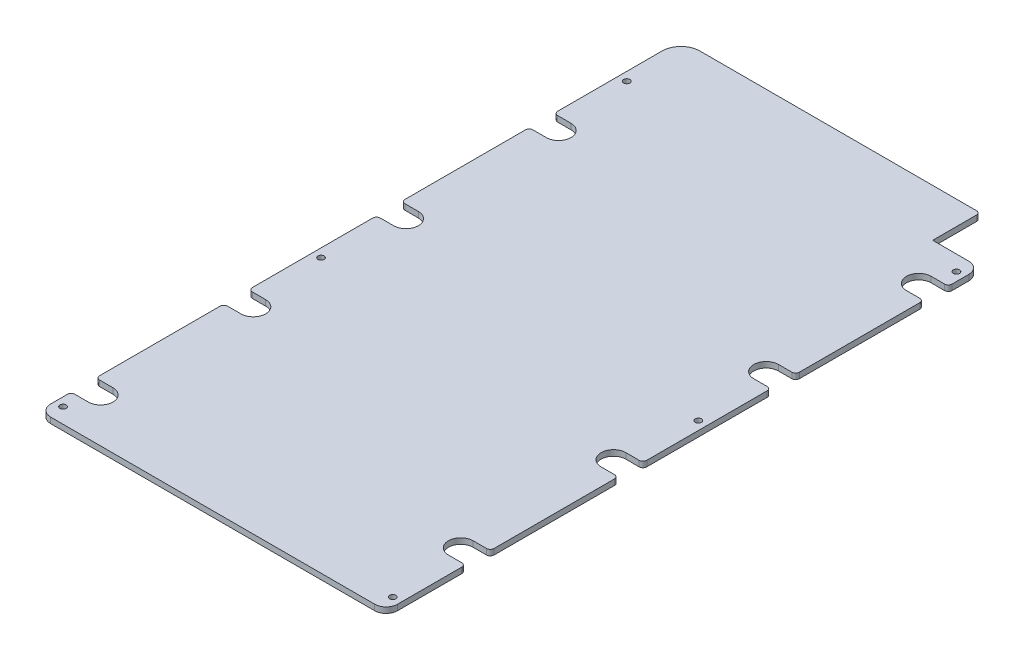
from build123d import *

# Parameters (mm, degrees)
BOSS_EXTRUDE1_DEPTH       = 3
FILLET1_R                 = 10
FILLET2_R                 = 6
F_4_CLEARANCE_HOLE1_D     = 3.2639
F_4_CLEARANCE_HOLE1_DEPTH = 3
F_4_CLEARANCE_HOLE1_TIP   = 0.980574487
FILLET3_R                 = 2


with BuildPart() as part:
    # Sketch1 → Boss-Extrude1 (new body)
    with BuildSketch(Plane(origin=(0, 0, 0), x_dir=(1, 0, 0), z_dir=(0, 1, 0))):
        with BuildLine():
            Line((-91.15, 34.109827366), (-82.15, 34.109827366))
            ThreePointArc((-82.15, 34.109827366), (-75.65, 27.609827366), (-82.15, 21.109827366))
            Line((-82.15, 21.109827366), (-91.15, 21.109827366))
            Line((-91.15, 21.109827366), (-91.15, -46.140172634))
            Line((-91.15, -46.140172634), (-82.15, -46.140172634))
            ThreePointArc((-82.15, -46.140172634), (-75.65, -52.640172634), (-82.15, -59.140172634))
            Line((-82.15, -59.140172634), (-91.15, -59.140172634))
            Line((-91.15, -59.140172634), (-91.15, -126.390172634))
            Line((-91.15, -126.390172634), (-82.15, -126.390172634))
            ThreePointArc((-82.15, -126.390172634), (-75.65, -132.890172634), (-82.15, -139.390172634))
            Line((-82.15, -139.390172634), (-91.15, -139.390172634))
            Line((-91.15, -139.390172634), (-91.15, -156.140172634))
            Line((-91.15, -156.140172634), (91.15, -156.140172634))
            Line((91.15, -156.140172634), (91.15, -114.390172634))
            Line((91.15, -114.390172634), (82.15, -114.390172634))
            ThreePointArc((82.15, -114.390172634), (75.65, -107.890172634), (82.15, -101.390172634))
            Line((82.15, -101.390172634), (91.15, -101.390172634))
            Line((91.15, -101.390172634), (91.15, -34.140172634))
            Line((91.15, -34.140172634), (82.15, -34.140172634))
            ThreePointArc((82.15, -34.140172634), (75.65, -27.640172634), (82.15, -21.140172634))
            Line((82.15, -21.140172634), (91.15, -21.140172634))
            Line((91.15, -21.140172634), (91.15, 46.109827366))
            Line((91.15, 46.109827366), (82.15, 46.109827366))
            ThreePointArc((82.15, 46.109827366), (75.65, 52.609827366), (82.15, 59.109827366))
            Line((82.15, 59.109827366), (91.15, 59.109827366))
            Line((91.15, 59.109827366), (91.15, 126.359827366))
            Line((91.15, 126.359827366), (82.15, 126.359827366))
            ThreePointArc((82.15, 126.359827366), (75.65, 132.859827366), (82.15, 139.359827366))
            Line((82.15, 139.359827366), (91.15, 139.359827366))
            Line((91.15, 139.359827366), (91.15, 156.140172634))
            Line((91.15, 156.140172634), (66.15, 156.140172634))
            Line((66.15, 156.140172634), (66.15, 181.140172634))
            Line((66.15, 181.140172634), (-91.15, 181.140172634))
            Line((-91.15, 181.140172634), (-91.15, 114.359827366))
            Line((-91.15, 114.359827366), (-82.15, 114.359827366))
            ThreePointArc((-82.15, 114.359827366), (-75.65, 107.859827366), (-82.15, 101.359827366))
            Line((-82.15, 101.359827366), (-91.15, 101.359827366))
            Line((-91.15, 101.359827366), (-91.15, 34.109827366))
        make_face()
    extrude(amount=BOSS_EXTRUDE1_DEPTH)

    # Fillet1
    fillet1_edges = [part.edges().sort_by_distance(p)[0] for p in [
        (-91.15, 1.5, -181.140172634),
    ]]
    fillet(fillet1_edges, radius=FILLET1_R)

    # Fillet2
    fillet2_edges = [part.edges().sort_by_distance(p)[0] for p in [
        (91.15, 1.5, 156.140172634),
        (-91.15, 1.5, 156.140172634),
        (91.15, 1.5, -156.140172634),
    ]]
    fillet(fillet2_edges, radius=FILLET2_R)

    # #4 Clearance Hole1
    with Locations(Plane(origin=(0, 3, 0), x_dir=(1, 0, 0), z_dir=(0, 1, 0))):
        with Locations((86.65, 148.140172634), (-86.65, -148.140172634), (-86.65, -12.515172634), (-86.65, 148.140172634), (86.65, 12.484827366), (86.65, -148.140172634)):
            Hole(F_4_CLEARANCE_HOLE1_D / 2, depth=F_4_CLEARANCE_HOLE1_DEPTH)
            with Locations((0, 0, -(F_4_CLEARANCE_HOLE1_DEPTH + F_4_CLEARANCE_HOLE1_TIP / 2))):  # 118° drill point
                Cone(0, F_4_CLEARANCE_HOLE1_D / 2, F_4_CLEARANCE_HOLE1_TIP, mode=Mode.SUBTRACT)

    # Fillet3
    fillet3_edges = [part.edges().sort_by_distance(p)[0] for p in [
        (-91.15, 1.5, -101.359827366),
        (-91.15, 1.5, -114.359827366),
        (-91.15, 1.5, -21.109827366),
        (-91.15, 1.5, -34.109827366),
        (-91.15, 1.5, 59.140172634),
        (-91.15, 1.5, 46.140172634),
        (-91.15, 1.5, 139.390172634),
        (-91.15, 1.5, 126.390172634),
        (91.15, 1.5, 101.390172634),
        (91.15, 1.5, 114.390172634),
        (91.15, 1.5, 34.140172634),
        (91.15, 1.5, 21.140172634),
        (91.15, 1.5, -46.109827366),
        (91.15, 1.5, -59.109827366),
        (91.15, 1.5, -126.359827366),
        (91.15, 1.5, -139.359827366),
        (66.15, 1.5, -181.140172634),
    ]]
    fillet(fillet3_edges, radius=FILLET3_R)


solid = part.part
